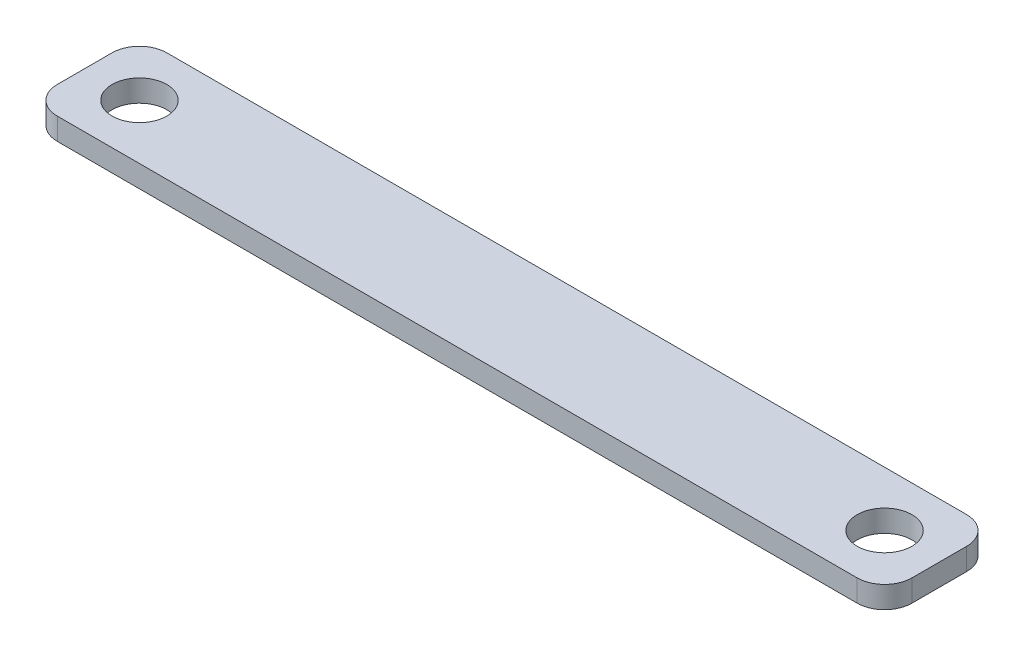
from build123d import *

# Parameters (mm, degrees)
SKETCH1_R           = 2.5
BOSS_EXTRUDE2_DEPTH = 2
FLEX1_OUTLINE_R     = 2.5
FLEX1_DEPTH         = 2


# Read off the part's stored shape, not the designer's step: Flex1
with BuildPart() as part:
    # Sketch1 → Boss-Extrude2 (new body)
    with BuildSketch(Plane(origin=(0, 0, 0), x_dir=(1, 0, 0), z_dir=(0, 1, 0))):
        with BuildLine():
            Line((2.5, 0), (47.5, 0))
            ThreePointArc((47.5, 0), (49.267766953, 0.732233047), (50, 2.5))
            Line((50, 2.5), (50, 7.5))
            ThreePointArc((50, 7.5), (49.267766953, 9.267766953), (47.5, 10))
            Line((47.5, 10), (2.5, 10))
            ThreePointArc((2.5, 10), (0.732233047, 9.267766953), (0, 7.5))
            Line((0, 7.5), (0, 2.5))
            ThreePointArc((0, 2.5), (0.732233047, 0.732233047), (2.5, 0))
        make_face()
        with Locations(Location((5, 5, 0), (0, 0, 270))):
            Circle(SKETCH1_R, mode=Mode.SUBTRACT)
        with Locations(Location((45, 5, 0), (0, 0, 270))):
            Circle(SKETCH1_R, mode=Mode.SUBTRACT)
    extrude(amount=BOSS_EXTRUDE2_DEPTH)

    # Flex1 outline → Flex1 (add)
    # profile 1 of 4: a face of its own
    with BuildSketch(Plane(origin=(0, 0, 0), x_dir=(1, 0, 0), z_dir=(0, 1, 0))):
        with BuildLine():
            Line((2.5, 10), (-11.161902987, 10))
            ThreePointArc((-11.161902987, 10), (-12.92966994, 9.267766953), (-13.661902987, 7.5))
            Line((-13.661902987, 7.5), (-13.661902987, 2.5))
            ThreePointArc((-13.661902987, 2.5), (-12.92966994, 0.732233047), (-11.161902987, 0))
            Line((-11.161902987, 0), (2.5, 0))
            ThreePointArc((2.5, 0), (0.732233047, 0.732233047), (0, 2.5))
            Line((0, 2.5), (0, 7.5))
            ThreePointArc((0, 7.5), (0.732233047, 9.267766953), (2.5, 10))
        make_face()
        with Locations((-8.661902987, 5)):
            Circle(FLEX1_OUTLINE_R, mode=Mode.SUBTRACT)
    # profile 2 of 4: a face of its own
    with BuildSketch(Plane(origin=(0, 0, 0), x_dir=(1, 0, 0), z_dir=(0, 1, 0))):
        with BuildLine():
            Line((61.838097013, 10), (47.5, 10))
            ThreePointArc((47.5, 10), (49.267766953, 9.267766953), (50, 7.5))
            Line((50, 7.5), (50, 2.5))
            ThreePointArc((50, 2.5), (49.267766953, 0.732233047), (47.5, 0))
            Line((47.5, 0), (61.838097013, 0))
            ThreePointArc((61.838097013, 0), (63.605863966, 0.732233047), (64.338097013, 2.5))
            Line((64.338097013, 2.5), (64.338097013, 7.5))
            ThreePointArc((64.338097013, 7.5), (63.605863966, 9.267766953), (61.838097013, 10))
        make_face()
        with Locations((59.338097013, 5)):
            Circle(FLEX1_OUTLINE_R, mode=Mode.SUBTRACT)
    # profile 3 of 4: a face of its own
    with BuildSketch(Plane(origin=(0, 0, 0), x_dir=(1, 0, 0), z_dir=(0, 1, 0))):
        with Locations((5, 5)):
            Circle(FLEX1_OUTLINE_R)
    # profile 4 of 4: a face of its own
    with BuildSketch(Plane(origin=(0, 0, 0), x_dir=(1, 0, 0), z_dir=(0, 1, 0))):
        with Locations((45, 5)):
            Circle(FLEX1_OUTLINE_R)
    extrude(amount=FLEX1_DEPTH)


solid = part.part
